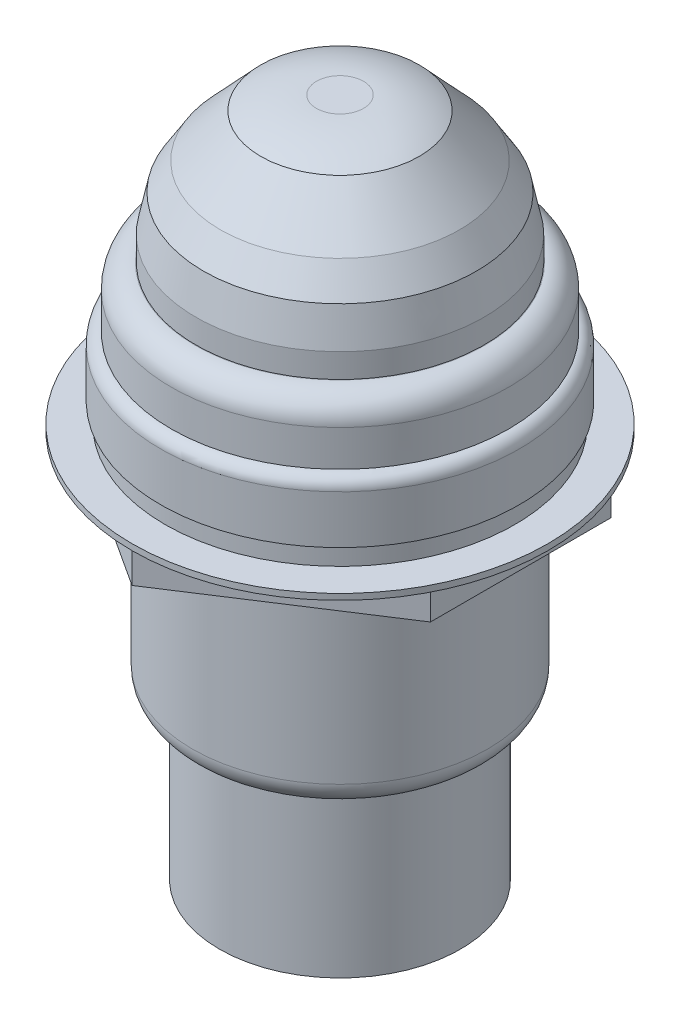
from build123d import *

# Parameters (mm, degrees)
SKETCH1_R           = 12.1412
BOSS_EXTRUDE1_DEPTH = 12.192
FILLET1_R           = 10.16
SKETCH3_R           = 14.224
BOSS_EXTRUDE2_DEPTH = 5.08
FILLET6_R           = 2.032
SKETCH8_R           = 15.121257553
BOSS_EXTRUDE3_DEPTH = 5.08
FILLET7_R           = 1.016
SKETCH9_W           = 0.127
SKETCH9_H           = 4.070962721
CUT_EXTRUDE1_DEPTH  = 0.254
SKETCH13_R          = 14.74025754
BOSS_EXTRUDE4_DEPTH = 1.6383
SKETCH14_R          = 17.526
BOSS_EXTRUDE5_DEPTH = 0.508
BOSS_EXTRUDE6_DEPTH = 2.54
SKETCH16_R          = 12.446
BOSS_EXTRUDE7_DEPTH = 16.51
SKETCH17_R          = 10.16
BOSS_EXTRUDE8_DEPTH = 13.716
FILLET8_R           = 2.032


with BuildPart() as part:
    # Sketch1 → Boss-Extrude1 (new body)
    with BuildSketch(Plane(origin=(0, 0, 0), x_dir=(1, 0, 0), z_dir=(0, 1, 0))):
        with Locations(Location((0, 0, 0), (0, 0, 90))):
            Circle(SKETCH1_R)
    extrude(amount=BOSS_EXTRUDE1_DEPTH)

    # Fillet1
    fillet1_edges = [part.edges().sort_by_distance(p)[0] for p in [
        (0, 12.192, 12.1412),
    ]]
    fillet(fillet1_edges, radius=FILLET1_R)

    # Sketch3 → Boss-Extrude2 (add)
    with BuildSketch(Plane.XZ):
        with Locations(Location((0, 0, 0), (0, 0, 270))):
            Circle(SKETCH3_R)
    extrude(amount=BOSS_EXTRUDE2_DEPTH)

    # Sketch4 → Cut-Revolve1 (revolve, cut)
    with BuildSketch(Plane(origin=(0, 0, 0), x_dir=(0, 0, -1), z_dir=(1, 0, 0))):
        Polygon((11.292993812, 6.096), (6.681516056, 11.039365263), (11.292993812, 11.039365263), align=None)
    revolve(axis=Axis((0, 0, 0), (0, 1, 0)), mode=Mode.SUBTRACT)

    # Sketch5 → Cut-Revolve2 (revolve, cut)
    with BuildSketch(Plane(origin=(0, 0, 0), x_dir=(0, 0, -1), z_dir=(1, 0, 0))):
        Polygon((12.1412, 2.032), (11.292993812, 6.096), (14.961110493, 2.032), align=None)
    revolve(axis=Axis((0, 0, 0), (0, 1, 0)), mode=Mode.SUBTRACT)

    # Sketch7 → Cut-Revolve3 (revolve, cut)
    with BuildSketch(Plane.XY, mode=Mode.PRIVATE) as cut_revolve3_sk:
        Polygon((-10.086523159, 7.389300203), (-11.857198071, 4.504575846), (-11.857198071, 7.389300203), align=None)
    revolve(cut_revolve3_sk.sketch.rotate(Axis((0, 0, 0), (0, 1, 0)), 270), axis=Axis((0, 0, 0), (0, 1, 0)), mode=Mode.SUBTRACT)

    # Fillet6
    fillet6_edges = [part.edges().sort_by_distance(p)[0] for p in [
        (0, 0, 14.224),
    ]]
    fillet(fillet6_edges, radius=FILLET6_R)

    # Sketch8 → Boss-Extrude3 (add)
    with BuildSketch(Plane.XZ.offset(5.08)):
        with Locations(Location((0, 0, 0), (0, 0, 270))):
            Circle(SKETCH8_R)
    extrude(amount=BOSS_EXTRUDE3_DEPTH)

    # Fillet7
    # the kernel refuses this fillet: 1.016 mm, written as the material it takes off along each edge
    with BuildSketch(Plane(origin=(0, -5.08, 0), x_dir=(0, 0, -1), z_dir=(-1, 0, 0))) as fillet7_piece_1:
        with BuildLine():
            CenterArc((14.105257553, 1.009037279), FILLET7_R, 276.711639073, 83.288360927)
            Line((14.224, 0), (14.226374849, -0.020180746))
            ThreePointArc((14.226374849, -0.020180746), (14.672628776, -0.02032), (15.121257553, -0.02032))
            Line((15.121257553, -0.02032), (15.141577553, 0))
            Line((15.141577553, 0), (15.141577553, 1.009037279))
            Line((15.141577553, 1.009037279), (15.121257553, 1.009037279))
        make_face()
    revolve(axis=Axis((0, -5.08, 0), (0, -1, 0)), mode=Mode.SUBTRACT)

    # Sketch9 → Cut-Extrude1 (cut)
    with BuildSketch(Plane(origin=(-15.24, 0, 0), x_dir=(0, 0, -1), z_dir=(1, 0, 0))):
        with Locations((-0.0635, -8.124518639)):
            Rectangle(SKETCH9_W, SKETCH9_H)
    extrude(amount=CUT_EXTRUDE1_DEPTH, mode=Mode.SUBTRACT)

    # Sketch13 → Boss-Extrude4 (add)
    with BuildSketch(Plane.XZ.offset(10.16)):
        with Locations(Location((0, 0, 0), (0, 0, 90))):
            Circle(SKETCH13_R)
    extrude(amount=BOSS_EXTRUDE4_DEPTH)

    # Sketch14 → Boss-Extrude5 (add)
    with BuildSketch(Plane.XZ.offset(11.7983)):
        with Locations(Location((0, 0, 0), (0, 0, 270))):
            Circle(SKETCH14_R)
    extrude(amount=BOSS_EXTRUDE5_DEPTH)

    # Sketch15 → Boss-Extrude6 (add)
    with BuildSketch(Plane.XZ.offset(12.3063)):
        Polygon((15.24, 7.62), (15.24, -7.597992884), (0, -17.526), (-15.24, -7.597992884), (-15.24, 7.62), (0, 17.526), align=None)
    extrude(amount=BOSS_EXTRUDE6_DEPTH)

    # Sketch16 → Boss-Extrude7 (add)
    with BuildSketch(Plane.XZ.offset(14.8463)):
        with Locations(Location((0, 0, 0), (0, 0, 270))):
            Circle(SKETCH16_R)
    extrude(amount=BOSS_EXTRUDE7_DEPTH)

    # Sketch17 → Boss-Extrude8 (add)
    with BuildSketch(Plane.XZ.offset(31.3563)):
        with Locations(Location((0, 0, 0), (0, 0, 270))):
            Circle(SKETCH17_R)
    extrude(amount=BOSS_EXTRUDE8_DEPTH)

    # Fillet8
    fillet8_edges = [part.edges().sort_by_distance(p)[0] for p in [
        (0, -31.3563, 12.446),
    ]]
    fillet(fillet8_edges, radius=FILLET8_R)


solid = part.part
